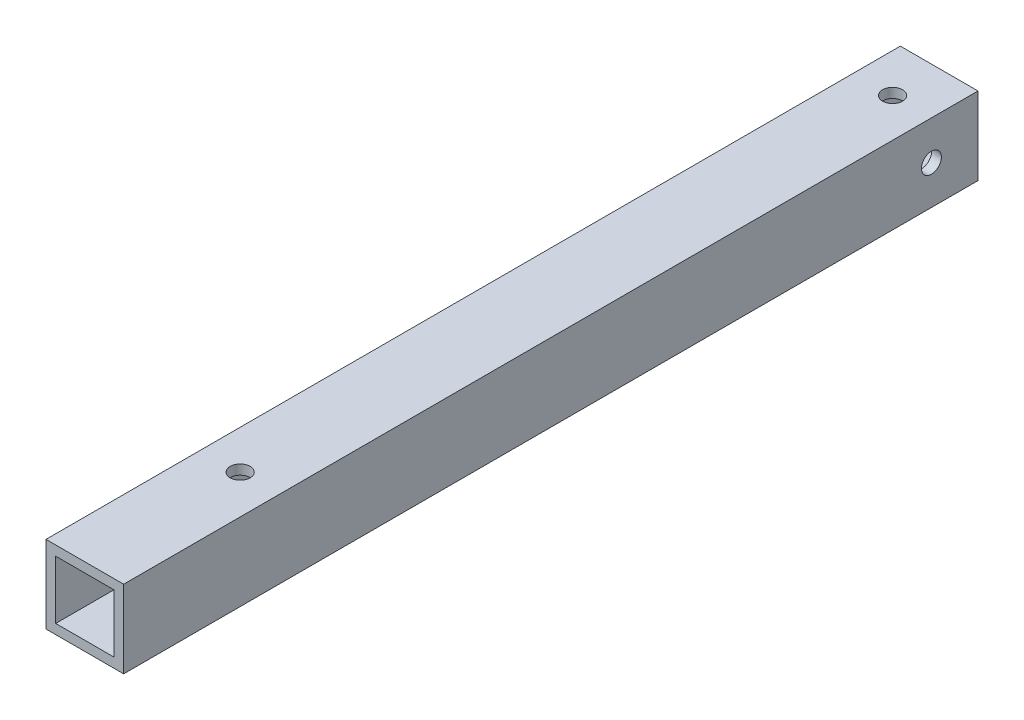
from build123d import *

# Parameters (mm, degrees)
SKETCH2_W           = 25.4
SKETCH2_H           = 25.4
BOSS_EXTRUDE1_DEPTH = 279.4
SKETCH4_W           = 19.05
SKETCH4_H           = 19.05
CUT_EXTRUDE1_DEPTH  = 280.9766776
SKETCH5_R           = 3.2639
CUT_EXTRUDE2_DEPTH  = 281.839473721
SKETCH6_R           = 3.2639
CUT_EXTRUDE3_DEPTH  = 281.839473721
SKETCH7_R           = 3.2639
CUT_EXTRUDE4_DEPTH  = 281.839473721


with BuildPart() as part:
    # Sketch2 → Boss-Extrude1 (new body)
    with BuildSketch(Plane.XY):
        Rectangle(SKETCH2_W, SKETCH2_H)
    extrude(amount=BOSS_EXTRUDE1_DEPTH)

    # Sketch4 → Cut-Extrude1 (cut, through all)
    with BuildSketch(Plane.XY):
        Rectangle(SKETCH4_W, SKETCH4_H)
    extrude(amount=CUT_EXTRUDE1_DEPTH, mode=Mode.SUBTRACT)

    # Sketch5 → Cut-Extrude2 (cut, through all)
    with BuildSketch(Plane(origin=(0, 12.7, 0), x_dir=(1, 0, 0), z_dir=(0, 1, 0))):
        with Locations((0, -15.24)):
            Circle(SKETCH5_R)
    extrude(amount=-CUT_EXTRUDE2_DEPTH, mode=Mode.SUBTRACT)

    # Sketch6 → Cut-Extrude3 (cut, through all)
    with BuildSketch(Plane(origin=(0, 12.7, 0), x_dir=(1, 0, 0), z_dir=(0, 1, 0))):
        with Locations((0, -228.6)):
            Circle(SKETCH6_R)
    extrude(amount=-CUT_EXTRUDE3_DEPTH, mode=Mode.SUBTRACT)

    # Sketch7 → Cut-Extrude4 (cut, through all)
    with BuildSketch(Plane.ZY.offset(12.7)):
        with Locations((15.24, 0)):
            Circle(SKETCH7_R)
    extrude(amount=-CUT_EXTRUDE4_DEPTH, mode=Mode.SUBTRACT)


solid = part.part
